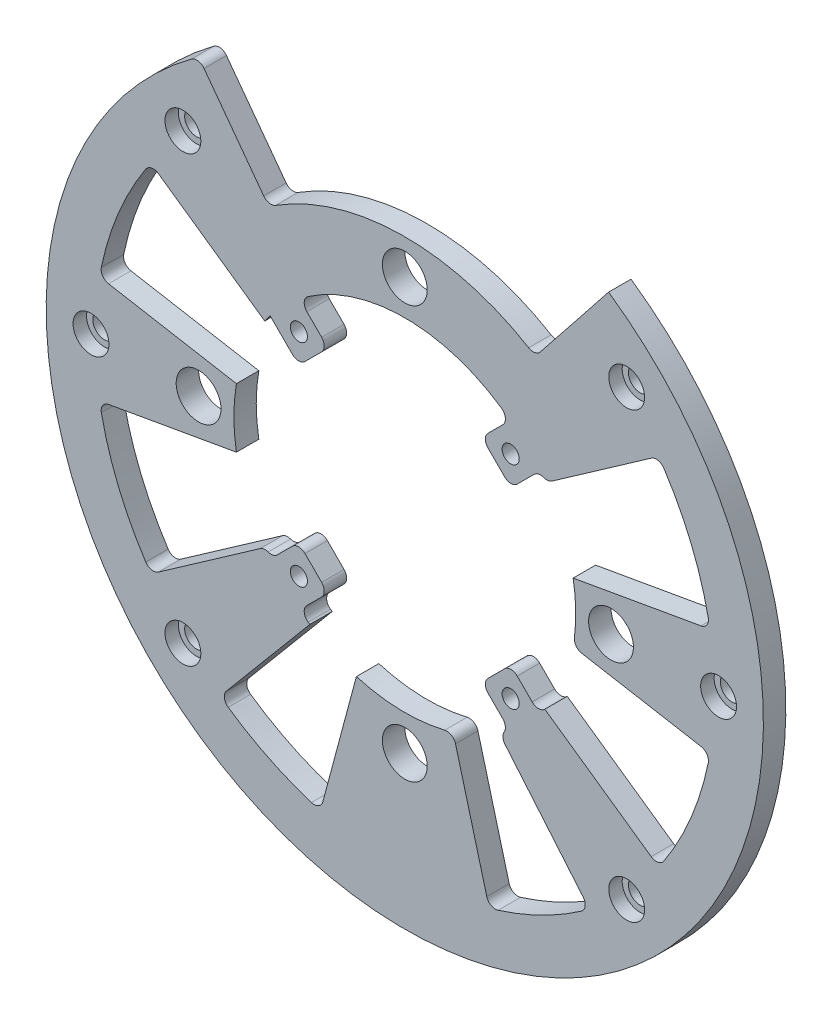
from build123d import *

# Parameters (mm, degrees)
SKETCH1_R                                        = 101.6
SKETCH1_R_2                                      = 48.435876627
EXTRUDE1_DEPTH                                   = 6.35
CBORE_FOR_1_4_SOCKET_HEAD_CAP_SCREW1_D           = 6.6294
CBORE_FOR_1_4_SOCKET_HEAD_CAP_SCREW1_CBORE_D     = 10.16
CBORE_FOR_1_4_SOCKET_HEAD_CAP_SCREW1_CBORE_DEPTH = 3.81
SKETCH12_R                                       = 6.35
CUT_EXTRUDE2_DEPTH                               = 144.824345992
SKETCH13_R                                       = 2.426498152
EXTRUDE2_DEPTH                                   = 6.35
CUT_EXTRUDE3_DEPTH                               = 6.35
FILLET1_R                                        = 2.54
FILLET2_R                                        = 2.54
FILLET3_R                                        = 2.54
FILLET6_R                                        = 2.54
FILLET9_R                                        = 2.54


with BuildPart() as part:
    # Sketch1 → Extrude1 (new body)
    with BuildSketch(Plane.XY):
        Circle(SKETCH1_R)
        Circle(SKETCH1_R_2, mode=Mode.SUBTRACT)
    extrude(amount=EXTRUDE1_DEPTH)

    # CBORE for 1/4 Socket Head Cap Screw1 (through all)
    with Locations(Plane.XY.offset(6.35)):
        with Locations((62.861792847, -62.861792847), (88.9, 0), (62.861792847, 62.861792847), (-62.861792847, 62.861792847), (-88.9, 0), (-62.861792847, -62.861792847)):
            CounterBoreHole(CBORE_FOR_1_4_SOCKET_HEAD_CAP_SCREW1_D / 2, CBORE_FOR_1_4_SOCKET_HEAD_CAP_SCREW1_CBORE_D / 2, CBORE_FOR_1_4_SOCKET_HEAD_CAP_SCREW1_CBORE_DEPTH)

    # Sketch12 → Cut-Extrude2 (cut, through all)
    with BuildSketch(Plane.XY.offset(6.35)):
        with Locations((0, -58.42)):
            Circle(SKETCH12_R)
        with Locations((-58.42, 0)):
            Circle(SKETCH12_R)
        with Locations((58.42, 0)):
            Circle(SKETCH12_R)
        with Locations(Location((0, 58.42, 0), (0, 0, 180))):
            Circle(SKETCH12_R)
    extrude(amount=-CUT_EXTRUDE2_DEPTH, mode=Mode.SUBTRACT)

    # Sketch13 → Extrude2 (add)
    # profile 1 of 4: a face of its own
    with BuildSketch(Plane.XY.offset(6.35)):
        Polygon((30.067243726, -21.76182967), (44.903973325, -36.598559269), (36.598559269, -44.903973325), (21.76182967, -30.067243726), align=None)
        with Locations((29.99994, -29.99994)):
            Circle(SKETCH13_R, mode=Mode.SUBTRACT)
    # profile 2 of 4: a face of its own
    with BuildSketch(Plane.XY.offset(6.35)):
        Polygon((-30.067243726, -21.76182967), (-44.903973325, -36.598559269), (-36.598559269, -44.903973325), (-21.76182967, -30.067243726), align=None)
        with Locations((-29.99994, -29.99994)):
            Circle(SKETCH13_R, mode=Mode.SUBTRACT)
    # profile 3 of 4: a face of its own
    with BuildSketch(Plane.XY.offset(6.35)):
        Polygon((-30.067243726, 21.76182967), (-21.76182967, 30.067243726), (-36.598559269, 44.903973325), (-44.903973325, 36.598559269), align=None)
        with Locations((-29.99994, 29.99994)):
            Circle(SKETCH13_R, mode=Mode.SUBTRACT)
    # profile 4 of 4: a face of its own
    with BuildSketch(Plane.XY.offset(6.35)):
        Polygon((30.067243726, 21.76182967), (21.76182967, 30.067243726), (36.598559269, 44.903973325), (44.903973325, 36.598559269), align=None)
        with Locations((29.99994, 29.99994)):
            Circle(SKETCH13_R, mode=Mode.SUBTRACT)
    extrude(amount=-EXTRUDE2_DEPTH)

    # Sketch14 → Cut-Extrude3 (cut)
    with BuildSketch(Plane.XY.offset(6.35)):
        with BuildLine():
            Line((36.978423652, 57.45466439), (71.6832833, 101.141012966))
            Line((71.6832833, 101.141012966), (0, 148.475476712))
            Line((0, 148.475476712), (-71.6832833, 101.141012966))
            Line((-71.6832833, 101.141012966), (-38.544806548, 56.41577939))
            ThreePointArc((-38.544806548, 56.41577939), (-0.939792187, 68.319536493), (36.978423652, 57.45466439))
        make_face()
        with BuildLine():
            Line((8.652633897, -27.580853172), (23.900424698, -84.486383146))
            ThreePointArc((23.900424698, -84.486383146), (38.731626442, -78.797464115), (52.295107345, -70.52943347))
            Line((52.295107345, -70.52943347), (14.227637724, -25.162389788))
            ThreePointArc((14.227637724, -25.162389788), (11.503866682, -26.518532886), (8.652633897, -27.580853172))
        make_face()
        with BuildLine():
            Line((-71.923131973, 50.361119179), (-23.678617266, 16.579946304))
            ThreePointArc((-23.678617266, 16.579946304), (-26.705896668, 11.061944595), (-28.467103301, 5.019518375))
            Line((-28.467103301, 5.019518375), (-86.468023222, 15.246645463))
            ThreePointArc((-86.468023222, 15.246645463), (-81.118407757, 33.600344651), (-71.923131973, 50.361119179))
        make_face()
        with BuildLine():
            Line((-8.652154992, -27.581003409), (-23.900424698, -84.486383146))
            ThreePointArc((-23.900424698, -84.486383146), (-38.731626442, -78.797464115), (-52.295107345, -70.52943347))
            Line((-52.295107345, -70.52943347), (-14.229539169, -25.161314554))
            ThreePointArc((-14.229539169, -25.161314554), (-11.504638432, -26.518198083), (-8.652154992, -27.581003409))
        make_face()
        with BuildLine():
            Line((-86.468023222, -15.246645463), (-28.467103301, -5.019518375))
            ThreePointArc((-28.467103301, -5.019518375), (-26.705896668, -11.061944595), (-23.678617266, -16.579946304))
            Line((-23.678617266, -16.579946304), (-71.923131973, -50.361119179))
            ThreePointArc((-71.923131973, -50.361119179), (-81.118407757, -33.600344651), (-86.468023222, -15.246645463))
        make_face()
        with BuildLine():
            Line((23.678617266, -16.579946304), (71.923131973, -50.361119179))
            ThreePointArc((71.923131973, -50.361119179), (81.118407757, -33.600344651), (86.468023222, -15.246645463))
            Line((86.468023222, -15.246645463), (28.467103301, -5.019518375))
            ThreePointArc((28.467103301, -5.019518375), (26.705896668, -11.061944595), (23.678617266, -16.579946304))
        make_face()
        with BuildLine():
            Line((28.467103301, 5.019518375), (86.468023222, 15.246645463))
            ThreePointArc((86.468023222, 15.246645463), (81.118407757, 33.600344651), (71.923131973, 50.361119179))
            Line((71.923131973, 50.361119179), (23.678617266, 16.579946304))
            ThreePointArc((23.678617266, 16.579946304), (26.705896668, 11.061944595), (28.467103301, 5.019518375))
        make_face()
    extrude(amount=-CUT_EXTRUDE3_DEPTH, mode=Mode.SUBTRACT)

    # Fillet1
    fillet1_edges = [part.edges().sort_by_distance(p)[0] for p in [
        (-21.76182967, 30.067243726, 3.175),
        (-30.067243726, 21.76182967, 3.175),
        (21.76182967, 30.067243726, 3.175),
        (30.067243726, 21.76182967, 3.175),
        (-58.363526169, 83.1640476, 3.175),
        (52.295107345, -70.52943347, 3.175),
        (23.900424698, -84.486383146, 3.175),
        (-23.900424698, -84.486383146, 3.175),
        (-52.295107345, -70.52943347, 3.175),
        (47.700026827, -8.41080171, 3.175),
        (86.468023222, -15.246645463, 3.175),
        (71.923131973, -50.361119179, 3.175),
        (-71.923131973, -50.361119179, 3.175),
        (-86.468023222, -15.246645463, 3.175),
        (71.923131973, 50.361119179, 3.175),
        (86.468023222, 15.246645463, 3.175),
        (-86.468023222, 15.246645463, 3.175),
        (-71.923131973, 50.361119179, 3.175),
        (29.843941288, -38.149355343, 3.175),
        (30.067243726, -21.76182967, 3.175),
        (21.76182967, -30.067243726, 3.175),
        (-21.76182967, -30.067243726, 3.175),
        (-30.067243726, -21.76182967, 3.175),
    ]]
    fillet(fillet1_edges, radius=FILLET1_R)

    # Fillet2
    # the kernel refuses this fillet: 2.54 mm, written as the material it adds along each edge
    with BuildSketch(Plane(origin=(-38.149355343, -29.843941288, 6.35), x_dir=(0.7071067811865481, 0.7071067811865469, 0), z_dir=(0, 0, -1))) as fillet2_piece_1:
        with BuildLine():
            CenterArc((2.918493499, -2.54), FILLET2_R, 90, 89.954594463)
            ThreePointArc((0.378494296, -2.537987111), (0.172436891, -1.271500497), (0, 0))
            Line((0, 0), (2.918493499, 0))
        make_face()
    extrude(amount=6.35)
    # the kernel refuses this fillet: 2.54 mm, written as the material it takes off along each edge
    with BuildSketch(Plane(origin=(39.676347356, 27.781677508, 12.541699401), x_dir=(0.8191520442889919, 0.5735764363510458, 0), z_dir=(0, 0, -1))) as fillet2_2_piece_1:
        with BuildLine():
            CenterArc((2.47667976, -2.54), FILLET2_R, 90, 87.143912429)
            ThreePointArc((-0.060165151, -2.413438175), (-0.015043624, -1.207093997), (0, 0))
            Line((0, 0), (2.47667976, 0))
        make_face()
    extrude(amount=18.733398802, mode=Mode.SUBTRACT)

    # Fillet3
    # the kernel refuses this fillet: 2.54 mm, written as the material it adds along each edge
    with BuildSketch(Plane(origin=(38.149355343, -29.843941288, 6.35), x_dir=(-0.7071067811865487, 0.7071067811865462, 0), z_dir=(0, 0, -1))) as fillet3_piece_1:
        with BuildLine():
            CenterArc((2.918493499, 2.54), FILLET3_R, 180.045405537, 89.954594463)
            ThreePointArc((0.378494296, 2.537987111), (0.172436891, 1.271500497), (0, 0))
            Line((0, 0), (2.918493499, 0))
        make_face()
    extrude(amount=6.35)
    with BuildSketch(Plane(origin=(-29.843941288, 38.149355343, 6.35), x_dir=(0.8065806519344794, 0.5911240579818674, 0), z_dir=(0, 0, -1))) as fillet3_piece_2:
        with BuildLine():
            CenterArc((2.961349729, 2.538748086), FILLET3_R, 171.236815401, 100.562162322)
            Line((0.451000474, 2.925719166), (0, 0))
            ThreePointArc((0, 0), (1.52054388, -0.023873044), (3.041087761, 0))
        make_face()
    extrude(amount=6.35)
    # the kernel refuses this fillet: 2.54 mm, written as the material it takes off along each edge
    with BuildSketch(Plane(origin=(26.907852458, -40.274081253, 12.135832501), x_dir=(0.6427876096865419, -0.7660444431189757, 0), z_dir=(0, 0, -1))) as fillet3_2_piece_1:
        with BuildLine():
            CenterArc((2.314333001, -2.54), FILLET3_R, 90, 70.288335328)
            Line((-0.076827818, -1.683291217), (-0.3159439, -1.597620338))
            ThreePointArc((-0.3159439, -1.597620338), (-0.19275198, -0.605010424), (-0.252489157, -0.027662711))
            Line((-0.252489157, -0.027662711), (0, 0.254))
            Line((0, 0.254), (2.314333001, 0.254))
            Line((2.314333001, 0.254), (2.314333001, 0))
        make_face()
    extrude(amount=17.921665003, mode=Mode.SUBTRACT)
    with BuildSketch(Plane(origin=(13.709958303, -46.455044807, 12.695601727), x_dir=(-0.9660206148643552, -0.2584650298533501, 0), z_dir=(0, 0, -1))) as fillet3_2_piece_2:
        with BuildLine():
            CenterArc((2.539069601, -2.539171394), FILLET3_R, 91.463547204, 88.51545472)
            Line((-0.000930229, -2.53824052), (0, 0))
            ThreePointArc((0, 0), (1.237097807, -0.015800898), (2.474195614, 0))
        make_face()
    extrude(amount=19.041203453, mode=Mode.SUBTRACT)

    # Fillet6
    fillet6_edges = [part.edges().sort_by_distance(p)[0] for p in [
        (-29.843941288, -38.149355343, 3.175),
        (-39.676347356, -27.781677508, 3.175),
        (38.149355343, 29.843941288, 3.175),
        (29.843941288, 38.149355343, 3.175),
    ]]
    fillet(fillet6_edges, radius=FILLET6_R)

    # Fillet9
    fillet9_edges = [part.edges().sort_by_distance(p)[0] for p in [
        (-38.544806548, 56.41577939, 3.175),
        (36.978423652, 57.45466439, 3.175),
    ]]
    fillet(fillet9_edges, radius=FILLET9_R)


solid = part.part
